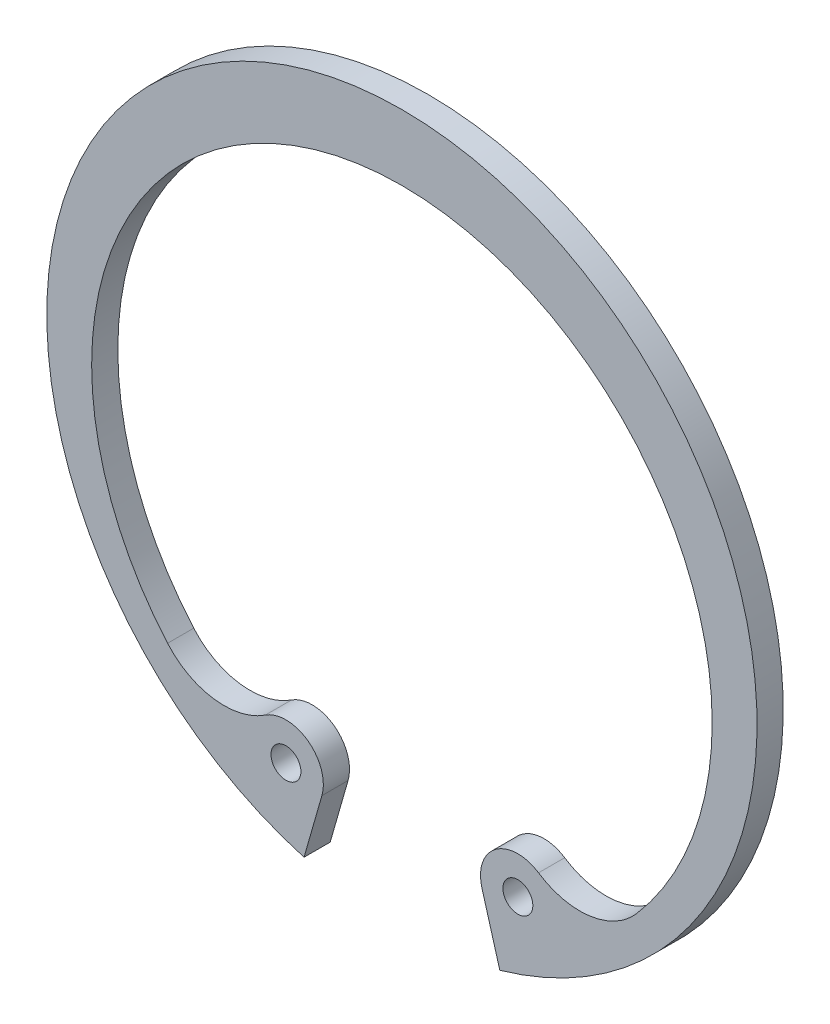
from build123d import *

# Parameters (mm, degrees)
SKETCH2_R           = 1
BOSS_EXTRUDE1_DEPTH = 1.75


with BuildPart() as part:
    # Sketch2 → Boss-Extrude1 (new body)
    with BuildSketch(Plane.XY):
        with BuildLine():
            Line((5.351990603, -18.664609332), (6.546387201, -22.829965279))
            ThreePointArc((6.546387201, -22.829965279), (0, 23.75), (-6.546387201, -22.829965279))
            Line((-6.546387201, -22.829965279), (-5.351990622, -18.664609398))
            ThreePointArc((-5.351990622, -18.664609398), (-6.277079647, -15.959251249), (-9.135419395, -15.891087439))
            ThreePointArc((-9.135419395, -15.891087439), (-12.571938491, -16.676326013), (-15.672466243, -14.999128717))
            ThreePointArc((-15.672466243, -14.999128717), (3.5e-08, 19.35), (15.672466197, -14.99912877))
            ThreePointArc((15.672466197, -14.99912877), (12.571938449, -16.676326019), (9.135419383, -15.891087431))
            ThreePointArc((9.135419383, -15.891087431), (6.277079669, -15.959251233), (5.351990603, -18.664609332))
        make_face()
        with Locations((7.755144841, -17.975515935)):
            Circle(SKETCH2_R, mode=Mode.SUBTRACT)
        with Locations((-7.755144841, -17.975515935)):
            Circle(SKETCH2_R, mode=Mode.SUBTRACT)
    extrude(amount=BOSS_EXTRUDE1_DEPTH)


solid = part.part
